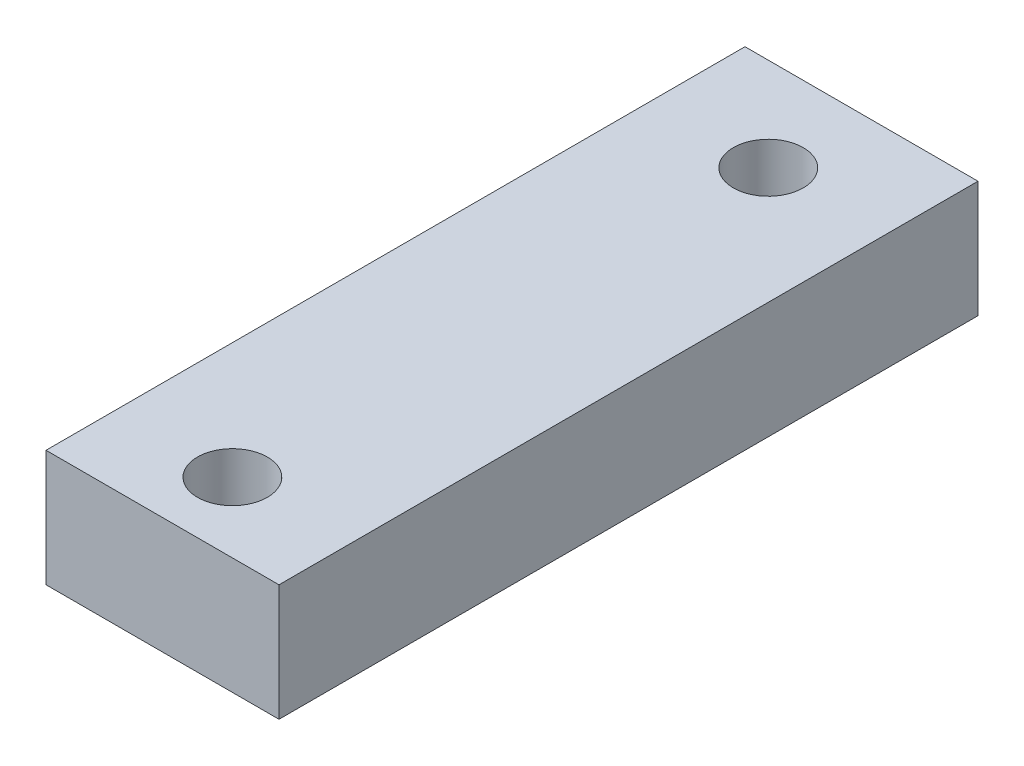
from build123d import *

# Parameters (mm, degrees)
SCHIZZO1_W                   = 10
SCHIZZO1_H                   = 5
ESTRUSIONE_ESTRUSIONE1_DEPTH = 30
SCHIZZO2_R                   = 1.5
TAGLIO_ESTRUSIONE1_DEPTH     = 33.015621187


with BuildPart() as part:
    # Schizzo1 → Estrusione-Estrusione1 (new body)
    with BuildSketch(Plane.XY):
        with Locations((-5, 2.5)):
            Rectangle(SCHIZZO1_W, SCHIZZO1_H)
    extrude(amount=ESTRUSIONE_ESTRUSIONE1_DEPTH)

    # Schizzo2 → Taglio-Estrusione1 (cut, through all)
    with BuildSketch(Plane(origin=(0, 0, 0), x_dir=(-1, 0, 0), z_dir=(0, -1, 0))):
        with Locations((5, -27)):
            Circle(SCHIZZO2_R)
        with Locations((5, -4)):
            Circle(SCHIZZO2_R)
    extrude(amount=-TAGLIO_ESTRUSIONE1_DEPTH, mode=Mode.SUBTRACT)


solid = part.part
